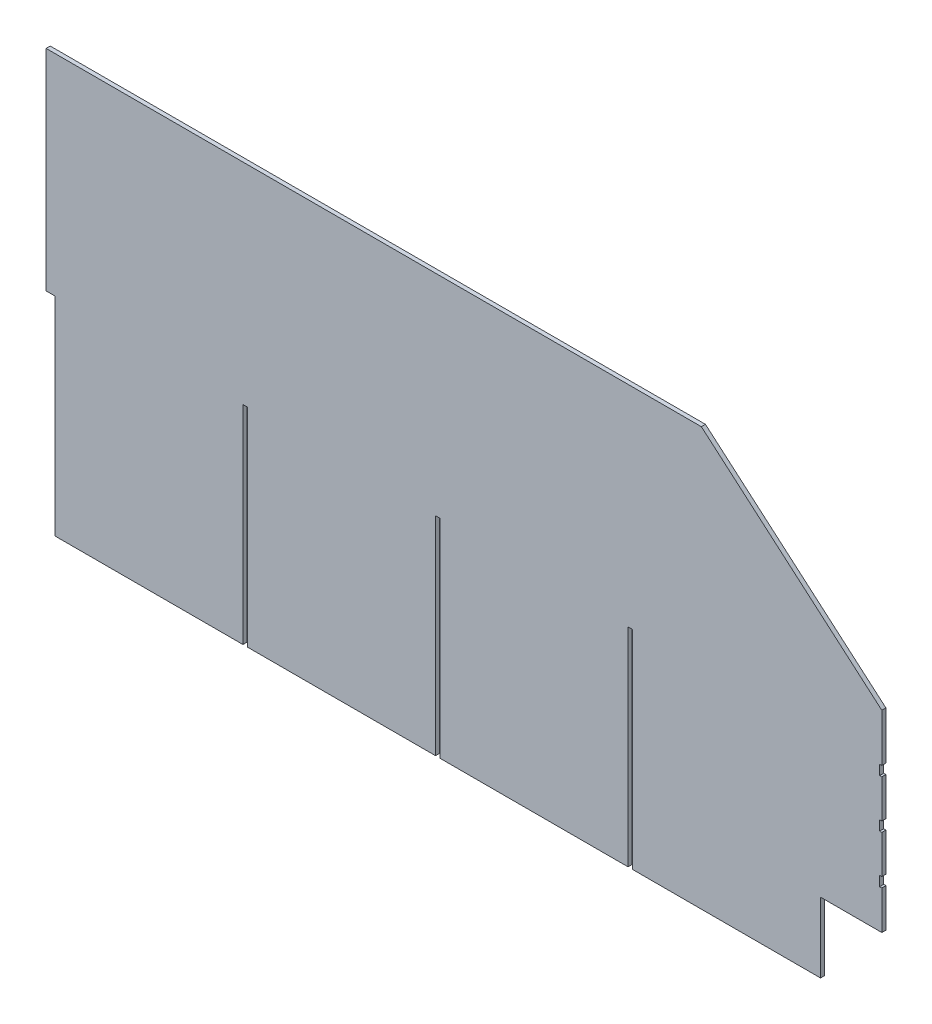
from build123d import *

# Parameters (mm, degrees)
BOSS_EXTRUDE1_DEPTH = 11.90625
SKETCH2_W           = 6.35
SKETCH2_H           = 28.575
CUT_EXTRUDE1_DEPTH  = 1684.490297393


with BuildPart() as part:
    # Sketch1 → Boss-Extrude1 (new body)
    with BuildSketch(Plane.XY):
        Polygon((-940.30453451, 792.210914928), (961.64746549, 792.210914928), (1485.39546549, 341.360914928), (1485.39546549, -217.439085072), (1307.59546549, -217.439085072), (1307.59546549, -420.639085072), (761.49546549, -420.639085072), (761.49546549, 182.610914928), (748.79546549, 182.610914928), (748.79546549, -420.639085072), (202.69546549, -420.639085072), (202.69546549, 182.610914928), (189.99546549, 182.610914928), (189.99546549, -420.639085072), (-356.10453451, -420.639085072), (-356.10453451, 182.610914928), (-368.80453451, 182.610914928), (-368.80453451, -420.639085072), (-914.90453451, -420.639085072), (-914.90453451, 182.610914928), (-940.30453451, 182.610914928), align=None)
    extrude(amount=BOSS_EXTRUDE1_DEPTH)

    # Sketch2 → Cut-Extrude1 (cut, through all)
    with BuildSketch(Plane.XY.offset(11.90625)):
        with Locations((1482.22046549, -91.201085072)):
            Rectangle(SKETCH2_W, SKETCH2_H)
        with Locations((1482.22046549, 48.498914928)):
            Rectangle(SKETCH2_W, SKETCH2_H)
        with Locations((1482.22046549, 188.198914928)):
            Rectangle(SKETCH2_W, SKETCH2_H)
    extrude(amount=-CUT_EXTRUDE1_DEPTH, mode=Mode.SUBTRACT)


solid = part.part
